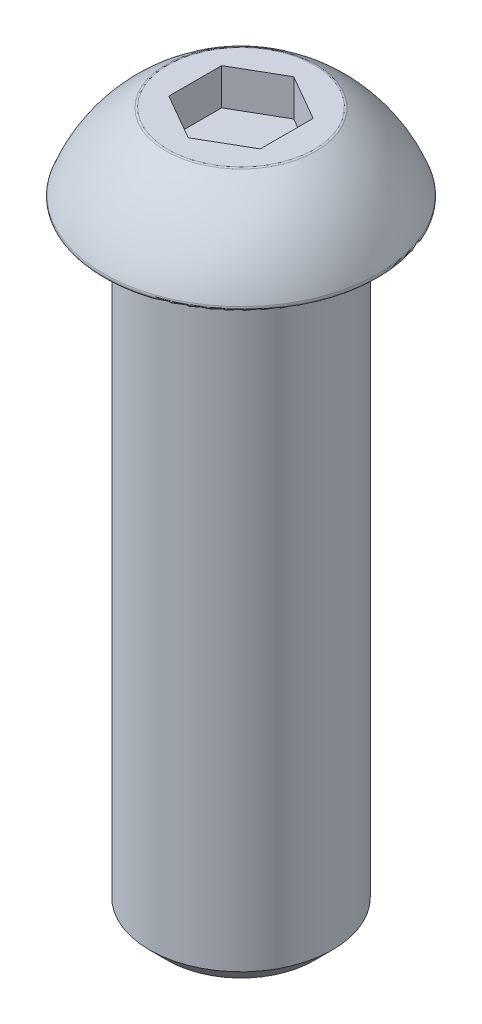
from build123d import *

# Parameters (mm, degrees)
SKETCH_4_R          = 2.5
EXTRUDE_4_DEPTH     = 17
CHAMFER_2_SIZE      = 0.5
CUT_EXTRUDE_2_DEPTH = 1


with BuildPart() as part:
    # 草圖4 → 填料-伸長4 (new body)
    with BuildSketch(Plane(origin=(0, 0, 0), x_dir=(1, 0, 0), z_dir=(0, 1, 0))):
        Circle(SKETCH_4_R)
    extrude(amount=-EXTRUDE_4_DEPTH)

    # 導角2
    chamfer_2_edges = [part.edges().sort_by_distance(p)[0] for p in [
        (-2.5, -17, 0),
    ]]
    chamfer(chamfer_2_edges, length=CHAMFER_2_SIZE)

    # 草圖6 → 旋轉1 (revolve)
    with BuildSketch(Plane.XY):
        with BuildLine():
            Line((3.659262232, 0), (0, 0))
            Line((0, 0), (0, 2.2))
            Line((0, 2.2), (1.998549895, 2.2))
            ThreePointArc((1.998549895, 2.2), (2.025128284, 2.196403264), (2.049794764, 2.185871785))
            ThreePointArc((2.049794764, 2.185871785), (3.077386207, 1.30632702), (3.753089468, 0.134589733))
            ThreePointArc((3.753089468, 0.134589733), (3.74129568, 0.042811598), (3.659262232, 0))
        make_face()
    revolve(axis=Axis((0, 0, 0), (0, 1, 0)))

    # 草圖7 → 除料-伸長2 (cut)
    with BuildSketch(Plane(origin=(0, 2.2, 0), x_dir=(1, 0, 0), z_dir=(0, 1, 0))):
        Polygon((1.25, 0.721687836), (0, 1.443375673), (-1.25, 0.721687836), (-1.25, -0.721687836), (0, -1.443375673), (1.25, -0.721687836), align=None)
    extrude(amount=-CUT_EXTRUDE_2_DEPTH, mode=Mode.SUBTRACT)


solid = part.part
